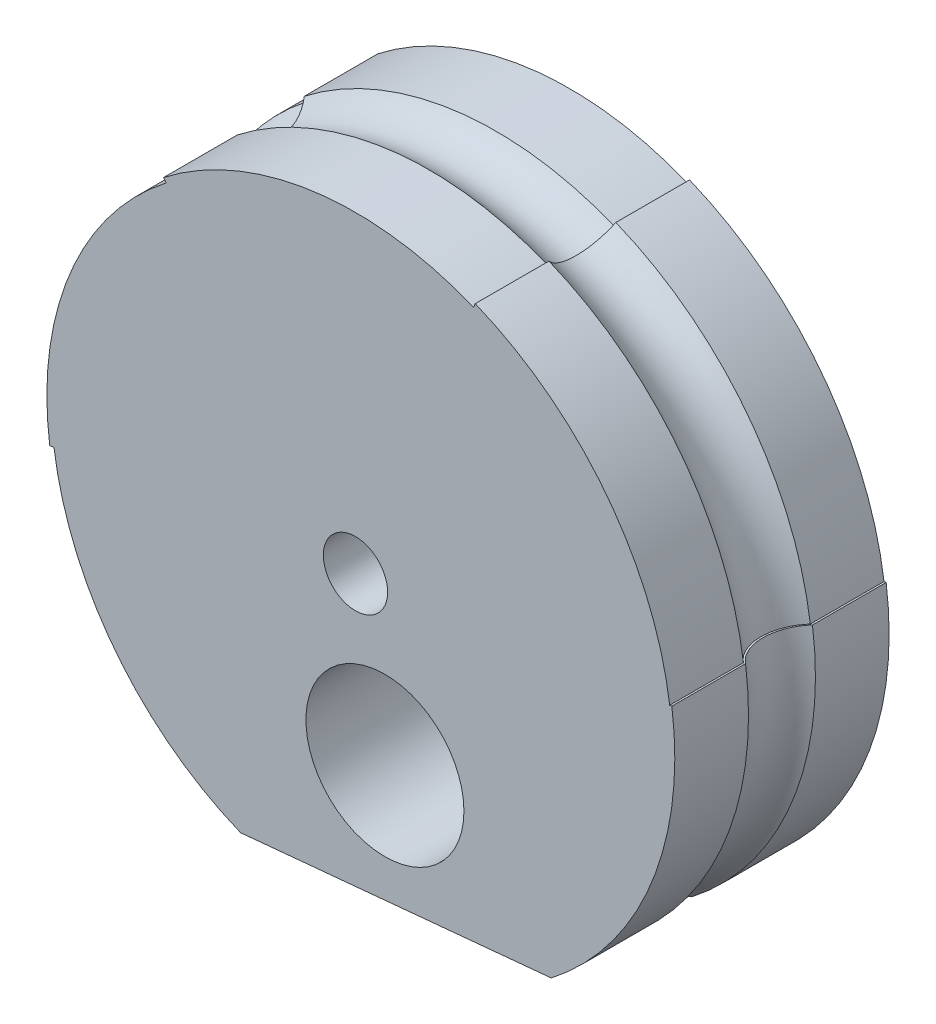
from build123d import *

# Parameters (mm, degrees)
SKETCH1_R           = 3.686275202
SKETCH1_R_2         = 1.5
BOSS_EXTRUDE1_DEPTH = 10
CUT_SWEEP1_ANGLE    = 65.162978
SKETCH3_R           = 2
SKETCH4_R           = 2
SKETCH5_R           = 2
CUT_SWEEP5_ANGLE    = 66.926183


# Read off the part's stored shape, not the designer's step: Cut-Sweep1, Cut-Sweep5
with BuildPart() as part:
    # Sketch1 → Boss-Extrude1 (new body)
    with BuildSketch(Plane.XY):
        with BuildLine():
            Line((49.491190341, 2.55078162), (63.988368206, 3.929851578))
            ThreePointArc((63.988368206, 3.929851578), (68.649398374, 10.07494702), (69.613421186, 17.727270865))
            Line((69.613421186, 17.727270865), (69.514351105, 17.71366502))
            ThreePointArc((69.514351105, 17.71366502), (66.543133225, 24.775071071), (60.439280034, 29.404819157))
            Line((60.439280034, 29.404819157), (60.363775967, 29.219618898))
            ThreePointArc((60.363775967, 29.219618898), (52.865525757, 30.164231855), (45.899544112, 27.233165568))
            Line((45.899544112, 27.233165568), (46.022180208, 27.075176998))
            ThreePointArc((46.022180208, 27.075176998), (41.517560448, 21.136292813), (40.585887394, 13.740758359))
            Line((40.585887394, 13.740758359), (40.784027557, 13.767970048))
            ThreePointArc((40.784027557, 13.767970048), (43.634790659, 6.992837216), (49.491190341, 2.55078162))
        make_face()
        with Locations((56.226488574, 8.636175254)):
            Circle(SKETCH1_R, mode=Mode.SUBTRACT)
        with Locations((54.851979087, 15.7)):
            Circle(SKETCH1_R_2, mode=Mode.SUBTRACT)
    extrude(amount=-BOSS_EXTRUDE1_DEPTH)

    # Cut-Sweep1 outline → Cut-Sweep1 (revolve, cut)
    with BuildSketch(Plane(origin=(54.851979087, 15.7, 0), x_dir=(0.5396064408716191, -0.8419173884472655, 0), z_dir=(-0.8419173884472655, -0.5396064408716191, 0))):
        with BuildLine():
            Line((14.9, -6.5612495), (14.9, -3.4387505))
            ThreePointArc((14.9, -3.4387505), (14.15, -5), (14.9, -6.5612495))
        make_face()
    revolve(axis=Axis((54.851979087, 15.7, 0), (0, 0, 1)), revolution_arc=CUT_SWEEP1_ANGLE, mode=Mode.SUBTRACT)

    # Cut-Sweep2: sweep along a curve in space
    with BuildLine() as cut_sweep2_path:
        ThreePointArc((69.514351105, 17.71366502, 0), (66.543133225, 24.775071071, 0), (60.439280034, 29.404819157, 0))
    # Sketch3 → Cut-Sweep2 (sweep, cut)
    with BuildSketch(Plane(origin=(41.545913318, -16.937802546, 0), x_dir=(0, 0, 1), z_dir=(-0.9260012944005722, 0.37752033424501136, 0))):
        with Locations((-5, 51.295957801)):
            Circle(SKETCH3_R)
    sweep(path=cut_sweep2_path.line, mode=Mode.SUBTRACT)

    # Cut-Sweep3: sweep along a curve in space
    with BuildLine() as cut_sweep3_path:
        ThreePointArc((60.363775967, 29.219618898, 0), (52.865525757, 30.164231855, 0), (45.899544112, 27.233165568, 0))
    # Sketch4 → Cut-Sweep3 (sweep, cut)
    with BuildSketch(Plane(origin=(41.832894366, 32.472113961, 0), x_dir=(0, 0, 1), z_dir=(-0.7899428471017035, -0.6131804777656041, 0))):
        with Locations((-5, -5.382060044)):
            Circle(SKETCH4_R)
    sweep(path=cut_sweep3_path.line, mode=Mode.SUBTRACT)

    # Cut-Sweep4: sweep along a curve in space
    with BuildLine() as cut_sweep4_path:
        ThreePointArc((46.022180208, 27.075176998, 0), (41.517560448, 21.136292813, 0), (40.585887394, 13.740758359, 0))
    # Sketch5 → Cut-Sweep4 (sweep, cut)
    with BuildSketch(Plane(origin=(-1.100839052, 8.015688586, 0), x_dir=(0.9907008120106874, 0.13605844729881716, 0), z_dir=(0.13605844729881716, -0.9907008120106874, 0))):
        with Locations((40.828017845, -5)):
            Circle(SKETCH5_R)
    sweep(path=cut_sweep4_path.line, mode=Mode.SUBTRACT)

    # Cut-Sweep5 outline → Cut-Sweep5 (revolve, cut)
    with BuildSketch(Plane(origin=(54.851979087, 15.7, 0), x_dir=(-0.9907008120106691, -0.13605844729894895, 0), z_dir=(-0.13605844729894895, 0.9907008120106691, 0))):
        with BuildLine():
            ThreePointArc((14.20000016, -3.438750372), (13.45, -5.000000221), (14.200000505, -6.561249904))
            Line((14.200000505, -6.561249904), (14.20000016, -3.438750372))
        make_face()
    revolve(axis=Axis((54.851979087, 15.7, 0), (0, 0, 1)), revolution_arc=CUT_SWEEP5_ANGLE, mode=Mode.SUBTRACT)


solid = part.part
